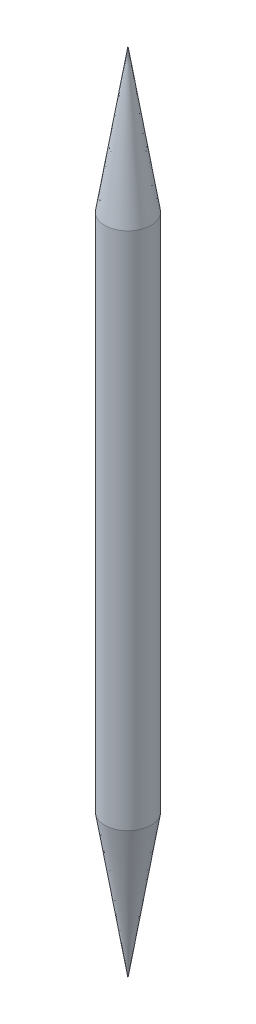
from build123d import *

# Parameters (mm, degrees)
SKETCH1_R           = 44.45
BOSS_EXTRUDE1_DEPTH = 1000


with BuildPart() as part:
    # Sketch1 → Boss-Extrude1 (new body)
    with BuildSketch(Plane(origin=(0, 0, 0), x_dir=(1, 0, 0), z_dir=(0, 1, 0))):
        Circle(SKETCH1_R)
    extrude(amount=BOSS_EXTRUDE1_DEPTH)

    # Sketch3 → Revolve3 (revolve)
    with BuildSketch(Plane.XY):
        Polygon((0, 1000), (0, 1276.86), (-44.45, 1000), align=None)
    revolve(axis=Axis((0, 1000, 0), (0, 1, 0)))

    # Sketch4 → Revolve4 (revolve)
    with BuildSketch(Plane.XY):
        Polygon((0, 0), (0, -276.86), (-44.45, 0), align=None)
    revolve(axis=Axis((0, 0, 0), (0, -1, 0)))


solid = part.part
